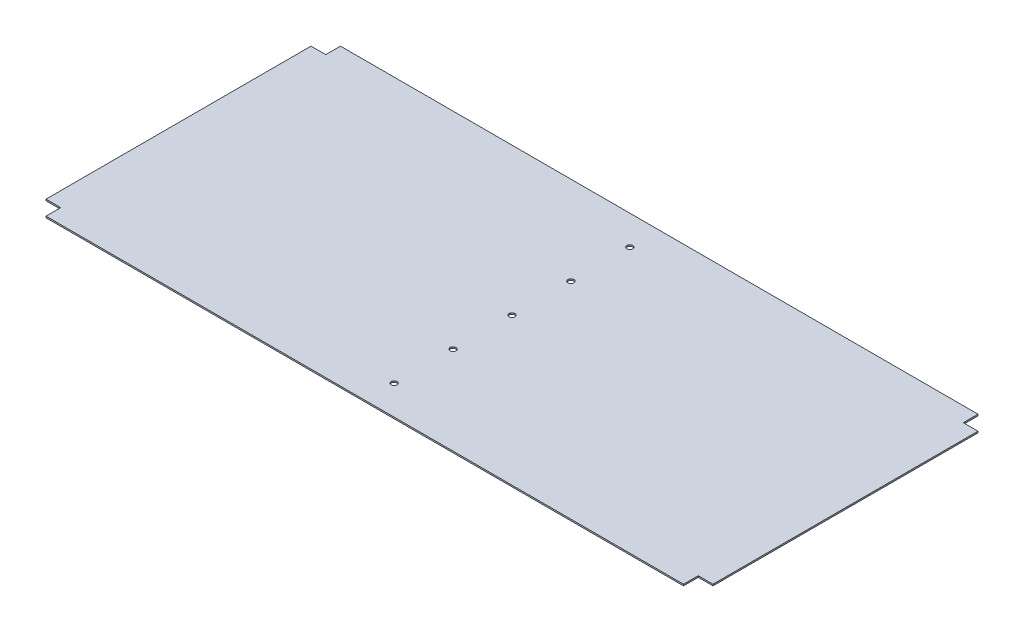
from build123d import *

# Parameters (mm, degrees)
SKETCH2_W          = 906
SKETCH2_H          = 400
BASE_FLANGE1_DEPTH = 2
SKETCH7_W          = 20
SKETCH7_H          = 20
CUT_EXTRUDE1_DEPTH = 10
SKETCH8_R          = 4
CUT_EXTRUDE2_DEPTH = 10


# Sheet-metal steps are written as plain solids
with BuildPart() as part:
    # Sketch2 → Base-Flange1 (new body)
    with BuildSketch(Plane(origin=(0, 0, 0), x_dir=(1, 0, 0), z_dir=(0, 1, 0))):
        with Locations((0, 200)):
            Rectangle(SKETCH2_W, SKETCH2_H)
    extrude(amount=-BASE_FLANGE1_DEPTH)

    # Sketch7 → Cut-Extrude1 (cut)
    with BuildSketch(Plane(origin=(0, 0, 0), x_dir=(1, 0, 0), z_dir=(0, 1, 0))):
        with Locations((-443, 390)):
            Rectangle(SKETCH7_W, SKETCH7_H)
        with Locations((-443, 10)):
            Rectangle(SKETCH7_W, SKETCH7_H)
        with Locations((443, 10)):
            Rectangle(SKETCH7_W, SKETCH7_H)
        with Locations((443, 390)):
            Rectangle(SKETCH7_W, SKETCH7_H)
    extrude(amount=-CUT_EXTRUDE1_DEPTH, mode=Mode.SUBTRACT)

    # Sketch8 → Cut-Extrude2 (cut)
    with BuildSketch(Plane(origin=(0, 0, 0), x_dir=(1, 0, 0), z_dir=(0, 1, 0))):
        with Locations(Location((0, 360, 0), (0, 0, 270))):
            Circle(SKETCH8_R)
        with Locations(Location((0, 280, 0), (0, 0, 270))):
            Circle(SKETCH8_R)
        with Locations(Location((0, 200, 0), (0, 0, 270))):
            Circle(SKETCH8_R)
        with Locations(Location((0, 120, 0), (0, 0, 270))):
            Circle(SKETCH8_R)
        with Locations(Location((0, 40, 0), (0, 0, 270))):
            Circle(SKETCH8_R)
    extrude(amount=-CUT_EXTRUDE2_DEPTH, mode=Mode.SUBTRACT)


solid = part.part
